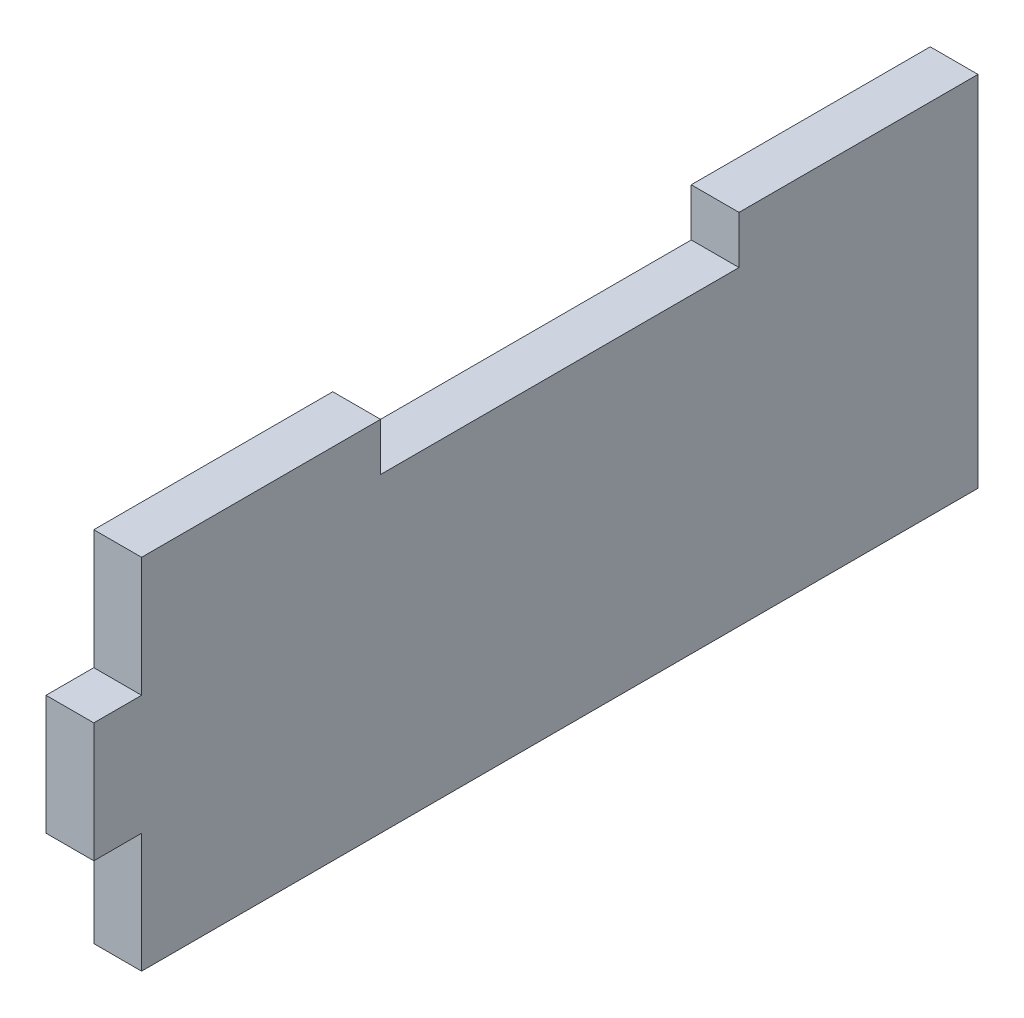
from build123d import *

# Parameters (mm, degrees)
AUFSATZ_LINEAR_AUSTRAGEN1_DEPTH = 4
SKIZZE3_W                       = 30
SKIZZE3_H                       = 4
SCHNITT_LINEAR_AUSTRAGEN2_DEPTH = 76.610845783


with BuildPart() as part:
    # Skizze1 → Aufsatz-Linear austragen1 (new body)
    with BuildSketch(Plane(origin=(0, 0, 0), x_dir=(0, 0, -1), z_dir=(1, 0, 0))):
        Polygon((0, -5), (0, 5), (4, 5), (4, 15), (74, 15), (74, -15), (4, -15), (4, -5), align=None)
    extrude(amount=AUFSATZ_LINEAR_AUSTRAGEN1_DEPTH)

    # Skizze3 → Schnitt-Linear austragen2 (cut, through all)
    with BuildSketch(Plane(origin=(4, 0, 0), x_dir=(0, 0, -1), z_dir=(1, 0, 0))):
        with Locations((39, 13)):
            Rectangle(SKIZZE3_W, SKIZZE3_H)
    extrude(amount=-SCHNITT_LINEAR_AUSTRAGEN2_DEPTH, mode=Mode.SUBTRACT)


solid = part.part
